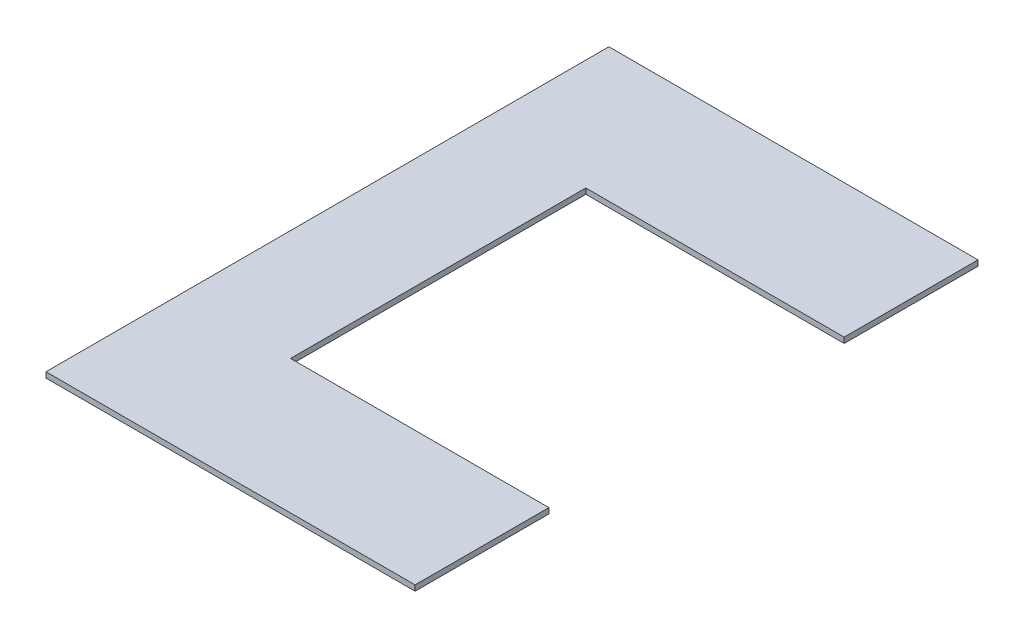
from build123d import *

# Parameters (mm, degrees)
SALIENTE_EXTRUIR1_DEPTH = 3
CROQUIS2_W              = 200
CROQUIS2_H              = 2.5
CORTAR_EXTRUIR1_DEPTH   = 10
CROQUIS3_W              = 140
CROQUIS3_H              = 160
CORTAR_EXTRUIR2_DEPTH   = 10


with BuildPart() as part:
    # Croquis1 → Saliente-Extruir1 (new body)
    with BuildSketch(Plane(origin=(0, 0, 0), x_dir=(1, 0, 0), z_dir=(0, 1, 0))):
        Polygon((0, 155), (-100, 155), (-150, 155), (-200, 155), (-200, -155), (-150, -155), (-100, -155), (0, -155), align=None)
    extrude(amount=SALIENTE_EXTRUIR1_DEPTH)

    # Croquis2 → Cortar-Extruir1 (cut)
    with BuildSketch(Plane(origin=(0, 3, 0), x_dir=(1, 0, 0), z_dir=(0, 1, 0))):
        with Locations((-100, 153.75)):
            Rectangle(CROQUIS2_W, CROQUIS2_H)
        with Locations((-100, -153.75)):
            Rectangle(CROQUIS2_W, CROQUIS2_H)
    extrude(amount=-CORTAR_EXTRUIR1_DEPTH, mode=Mode.SUBTRACT)

    # Croquis3 → Cortar-Extruir2 (cut)
    with BuildSketch(Plane(origin=(0, 3, 0), x_dir=(1, 0, 0), z_dir=(0, 1, 0))):
        with Locations((-70, 0)):
            Rectangle(CROQUIS3_W, CROQUIS3_H)
    extrude(amount=-CORTAR_EXTRUIR2_DEPTH, mode=Mode.SUBTRACT)


solid = part.part
